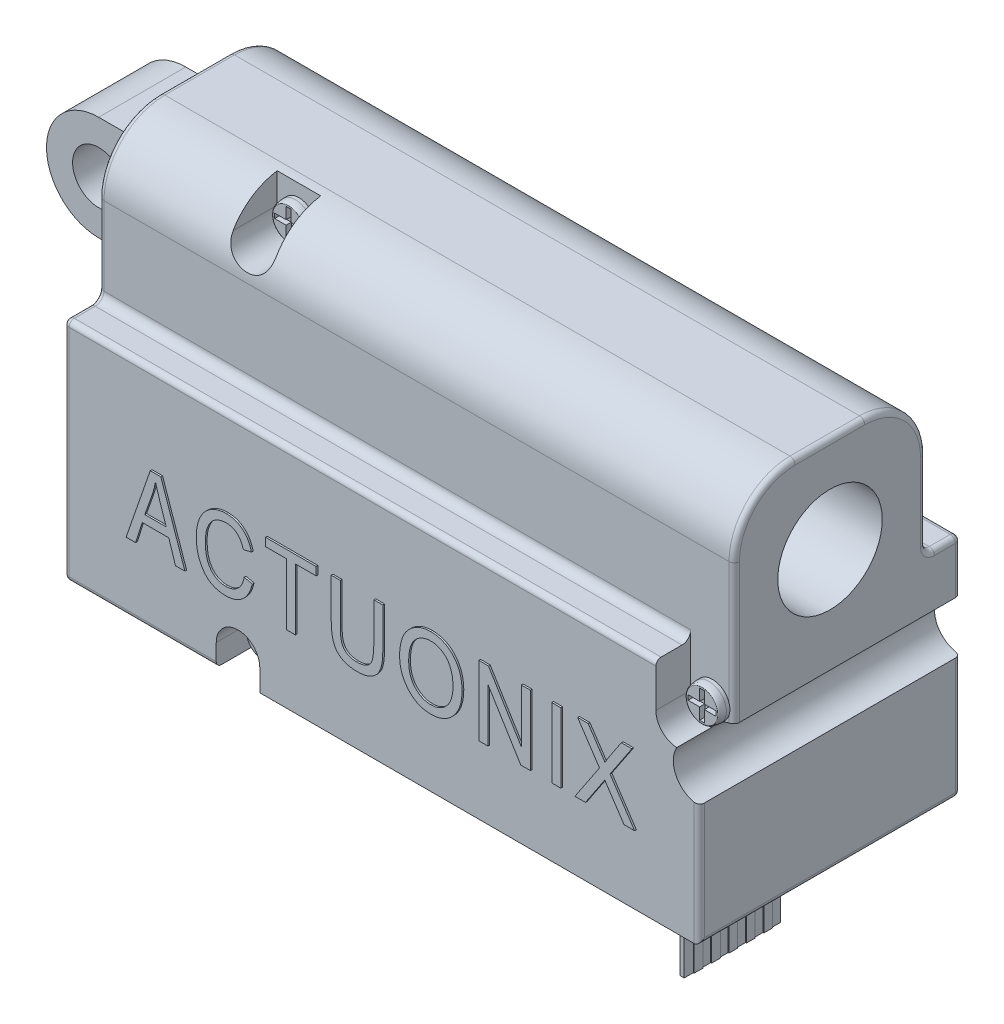
from build123d import *

# Parameters (mm, degrees)
SKETCH1_W             = 36.5
SKETCH1_H             = 21.5
BOSS_EXTRUDE1_DEPTH   = 7.5
SKETCH2_W             = 2
SKETCH2_H             = 8.5
CUT_EXTRUDE1_DEPTH    = 39.782244649
SKETCH3_W             = 5
SKETCH3_H             = 6
BOSS_EXTRUDE2_DEPTH   = 6
SKETCH4_R             = 1.5
CUT_EXTRUDE2_DEPTH    = 29.348280371
SKETCH5_R             = 1.5
CUT_EXTRUDE3_DEPTH    = 31.473349012
SKETCH7_W             = 0.51948052
SKETCH7_H             = 4
LETTERING_DEPTH       = 0.1
SKETCH8_W             = 0.5
SKETCH8_H             = 5.523886488
CUT_EXTRUDE5_DEPTH    = 1
BOSS_EXTRUDE4_DEPTH   = 0.1
SKETCH10_W            = 0.25
SKETCH10_H            = 5.523886488
WIRES_2_DEPTH         = 7
SKETCH11_W            = 0.5
SKETCH11_H            = 7
BOSS_EXTRUDE6_DEPTH   = 0.05
CUT_EXTRUDE6_DEPTH    = 2
CUT_EXTRUDE7_DEPTH    = 3
SKETCH14_R            = 1
BOSS_EXTRUDE7_DEPTH   = 0.6
BOSS_EXTRUDE7_2_DEPTH = 0.6
SKETCH15_W            = 0.6625
SKETCH15_H            = 0.275
SKETCH15_W_2          = 0.275
SKETCH15_H_2          = 0.6625
CUT_EXTRUDE8_DEPTH    = 0.3
SKETCH16_R            = 1
BOSS_EXTRUDE8_DEPTH   = 0.6
SKETCH17_W            = 0.275
SKETCH17_H            = 0.6625
SKETCH17_W_2          = 0.6625
SKETCH17_H_2          = 0.275
CUT_EXTRUDE9_DEPTH    = 0.3
FILLET6_SIZE          = 0.4
FILLET6_SIZE_2        = 0.1
FILLET7_SIZE          = 0.4
FILLET7_SIZE_2        = 0.1
FILLET8_SIZE          = 0.4
FILLET8_SIZE_2        = 0.1
FILLET1_R             = 3.5
FILLET2_R             = 1
FILLET3_R             = 0.5
FILLET4_R             = 0.5
FILLET5_R             = 0.3
SKETCH6_R             = 3
CUT_EXTRUDE4_DEPTH    = 25


with BuildPart() as part:
    # Sketch1 → Boss-Extrude1 (new, symmetric)
    with BuildSketch(Plane.XY):
        Rectangle(SKETCH1_W, SKETCH1_H)
    extrude(amount=BOSS_EXTRUDE1_DEPTH, both=True)

    # Sketch2 → Cut-Extrude1 (cut, through all)
    with BuildSketch(Plane(origin=(18.25, 0, 0), x_dir=(0, 0, -1), z_dir=(1, 0, 0))):
        with Locations((-6.5, 6.5)):
            Rectangle(SKETCH2_W, SKETCH2_H)
        with Locations((6.5, 6.5)):
            Rectangle(SKETCH2_W, SKETCH2_H)
    extrude(amount=-CUT_EXTRUDE1_DEPTH, mode=Mode.SUBTRACT)

    # Sketch3 → Boss-Extrude2 (add)
    with BuildSketch(Plane.ZY.offset(18.25)):
        with Locations((0, 5.25)):
            Rectangle(SKETCH3_W, SKETCH3_H)
    extrude(amount=BOSS_EXTRUDE2_DEPTH)

    # Sketch4 → Cut-Extrude2 (cut, through all)
    with BuildSketch(Plane.XY.offset(2.5)):
        with BuildLine():
            ThreePointArc((-24.25, 5.25), (-23.371320344, 7.371320344), (-21.25, 8.25))
            Line((-21.25, 8.25), (-24.25, 8.25))
            Line((-24.25, 8.25), (-24.25, 5.25))
        make_face()
        with BuildLine():
            Line((-24.25, 2.25), (-21.25, 2.25))
            ThreePointArc((-21.25, 2.25), (-23.371320344, 3.128679656), (-24.25, 5.25))
            Line((-24.25, 5.25), (-24.25, 2.25))
        make_face()
        with Locations((-21.25, 5.25)):
            Circle(SKETCH4_R)
    extrude(amount=-CUT_EXTRUDE2_DEPTH, mode=Mode.SUBTRACT)

    # Sketch5 → Cut-Extrude3 (cut, through all)
    with BuildSketch(Plane.XY.offset(7.5)):
        with Locations((18.25, -2.25)):
            Circle(SKETCH5_R)
    extrude(amount=-CUT_EXTRUDE3_DEPTH, mode=Mode.SUBTRACT)

    # Sketch7 → Lettering (add)
    # profile 1 of 8: a face of its own
    with BuildSketch(Plane.XY.offset(7.5)):
        Polygon((-14.576623377, -6.75), (-13.191071429, -2.75), (-12.58474026, -2.75), (-11.2, -6.75), (-11.744642857, -6.75), (-12.125324675, -5.555194805), (-13.651298701, -5.555194805), (-14.031980519, -6.75), align=None)
        with BuildLine():
            Line((-13.501948052, -5.087662338), (-12.274675325, -5.087662338))
            Line((-12.274675325, -5.087662338), (-12.639935065, -3.988636364))
            add(Edge.make_bspline(
                [(-12.639935065, -3.988636364), (-12.65351375, -3.947527264), (-12.680027416, -3.86725786), (-12.717907401, -3.749746161), (-12.754167393, -3.63825963), (-12.786379727, -3.532378588), (-12.815469797, -3.432419975), (-12.842520621, -3.338609172), (-12.866920344, -3.250751988), (-12.881375447, -3.193748887), (-12.888311688, -3.166396104)],
                knots=[0, 0, 0, 0, 1.209410234, 2.361487807, 3.449058128, 4.484314046, 5.452976395, 6.357250795, 7.211731278, 8, 8, 8, 8], degree=3))
            add(Edge.make_bspline(
                [(-12.888311688, -3.166396104), (-12.901124878, -3.230075207), (-12.926741471, -3.357384774), (-12.973319058, -3.547258788), (-13.027450773, -3.736275415), (-13.069383114, -3.861081563), (-13.090422078, -3.923701299)],
                knots=[0, 0, 0, 0, 0.993501098, 1.986243324, 2.98962581, 4, 4, 4, 4], degree=3))
            Line((-13.090422078, -3.923701299), (-13.501948052, -5.087662338))
        make_face(mode=Mode.SUBTRACT)
    # profile 2 of 8: a face of its own
    with BuildSketch(Plane.XY.offset(7.5)):
        with BuildLine():
            Line((-7.792207792, -5.347402597), (-7.324675325, -5.451298701))
            add(Edge.make_bspline(
                [(-7.324675325, -5.451298701), (-7.338507843, -5.506447179), (-7.365542684, -5.614231621), (-7.418142329, -5.768179781), (-7.476165414, -5.912074032), (-7.542738908, -6.04496921), (-7.617774687, -6.166698293), (-7.698608355, -6.278963676), (-7.788572676, -6.379120178), (-7.885390202, -6.468700678), (-7.988420918, -6.547487897), (-8.097526444, -6.615465217), (-8.21190664, -6.673069348), (-8.331730731, -6.720257116), (-8.456909189, -6.757236415), (-8.587689795, -6.782430923), (-8.723834237, -6.799756731), (-8.816502321, -6.801209252), (-8.863636364, -6.801948052)],
                knots=[0, 0, 0, 0, 1.220293167, 2.384990924, 3.489669754, 4.549651254, 5.57188532, 6.557220986, 7.51582152, 8.457228578, 9.385586102, 10.296327526, 11.213420288, 12.131450933, 13.057916225, 14.011504525, 14.988585638, 16, 16, 16, 16], degree=3))
            add(Edge.make_bspline(
                [(-8.863636364, -6.801948052), (-8.905058048, -6.801419118), (-8.986688304, -6.80037674), (-9.106460448, -6.789348014), (-9.221790988, -6.772704962), (-9.332301166, -6.747983357), (-9.438876482, -6.717626517), (-9.540431245, -6.679115624), (-9.637597996, -6.634671315), (-9.729668118, -6.582173073), (-9.818184169, -6.52293947), (-9.901393032, -6.454223711), (-9.981739073, -6.378558724), (-10.056960745, -6.293706075), (-10.128817557, -6.200858259), (-10.195643045, -6.099262848), (-10.259460729, -5.989995939), (-10.318128719, -5.872834798), (-10.372152418, -5.748765883), (-10.417667338, -5.617992469), (-10.45807264, -5.48252656), (-10.489241164, -5.341069606), (-10.514621378, -5.194576317), (-10.531927893, -5.042251512), (-10.544131522, -4.884668646), (-10.545008707, -4.777621958), (-10.545454545, -4.723214286)],
                knots=[0, 0, 0, 0, 0.987444875, 1.945970532, 2.865691915, 3.764214811, 4.644225399, 5.505809035, 6.35159498, 7.189444901, 8.03046832, 8.887959934, 9.759606025, 10.659725721, 11.58885776, 12.556911331, 13.557234418, 14.604595256, 15.679628512, 16.781526208, 17.904378674, 19.048529781, 20.233287979, 21.448073357, 22.70295484, 24, 24, 24, 24], degree=3))
            add(Edge.make_bspline(
                [(-10.545454545, -4.723214286), (-10.545011349, -4.66961834), (-10.544141797, -4.564463033), (-10.531999977, -4.410110988), (-10.514590546, -4.261860909), (-10.489608069, -4.119785185), (-10.456867106, -3.984140374), (-10.418547579, -3.854397692), (-10.370736364, -3.731716174), (-10.317802854, -3.61476854), (-10.257196775, -3.505175571), (-10.19226788, -3.401844132), (-10.12266503, -3.304803719), (-10.046935004, -3.21551783), (-9.966492373, -3.133172157), (-9.88076966, -3.058318847), (-9.790363002, -2.989688546), (-9.694774651, -2.928209444), (-9.595035603, -2.874060447), (-9.492559875, -2.826818588), (-9.387380921, -2.786790523), (-9.279140063, -2.754317756), (-9.167928456, -2.729124127), (-9.053719381, -2.711644238), (-8.936952756, -2.69943788), (-8.85798646, -2.698516426), (-8.818181818, -2.698051948)],
                knots=[0, 0, 0, 0, 1.28714434, 2.525378668, 3.716880711, 4.871983872, 5.988084826, 7.067553269, 8.118870607, 9.148405561, 10.148997021, 11.124535523, 12.078797495, 13.015004836, 13.934205159, 14.841541352, 15.746266633, 16.658501295, 17.568835417, 18.470356714, 19.36722721, 20.269895764, 21.182824756, 22.103907324, 23.044234137, 24, 24, 24, 24], degree=3))
            add(Edge.make_bspline(
                [(-8.818181818, -2.698051948), (-8.774865529, -2.699077146), (-8.689364601, -2.701100759), (-8.563463317, -2.714423933), (-8.44278129, -2.739814007), (-8.325999165, -2.771248402), (-8.214589884, -2.815279728), (-8.107070087, -2.866627524), (-8.004999519, -2.929215416), (-7.907714063, -3.000508735), (-7.815798757, -3.080784043), (-7.730996424, -3.170482234), (-7.65412937, -3.269374023), (-7.582563764, -3.375839973), (-7.520641009, -3.49279894), (-7.464660804, -3.617740579), (-7.415324234, -3.751604995), (-7.38972891, -3.845023973), (-7.376623377, -3.892857143)],
                knots=[0, 0, 0, 0, 1.022275984, 2.017844681, 2.982003421, 3.930067028, 4.867949935, 5.804571516, 6.73859987, 7.688703687, 8.647902883, 9.614426418, 10.596638918, 11.600688327, 12.637652993, 13.715085674, 14.83005897, 16, 16, 16, 16], degree=3))
            Line((-7.376623377, -3.892857143), (-7.844155844, -3.996753247))
            add(Edge.make_bspline(
                [(-7.844155844, -3.996753247), (-7.85464396, -3.963093169), (-7.875118898, -3.897381842), (-7.910746313, -3.802881022), (-7.950735459, -3.715256431), (-7.993369371, -3.63331355), (-8.041555622, -3.558825531), (-8.092708175, -3.490390556), (-8.147188722, -3.427847472), (-8.206639604, -3.372904194), (-8.26930522, -3.323943922), (-8.335614238, -3.281043995), (-8.406288264, -3.245676607), (-8.480643548, -3.216119319), (-8.558693841, -3.193541851), (-8.640415775, -3.177299478), (-8.725944033, -3.167354867), (-8.78433431, -3.166182516), (-8.814123377, -3.165584416)],
                knots=[0, 0, 0, 0, 1.220199917, 2.382078738, 3.492743967, 4.55265868, 5.57620237, 6.559539882, 7.508379445, 8.442687966, 9.356879029, 10.258317357, 11.171356441, 12.087847118, 13.024359035, 13.979417542, 14.969156017, 16, 16, 16, 16], degree=3))
            add(Edge.make_bspline(
                [(-8.814123377, -3.165584416), (-8.843907365, -3.16595512), (-8.902509009, -3.166684503), (-8.988943327, -3.175352184), (-9.0722254, -3.187946225), (-9.15243404, -3.206095286), (-9.229896696, -3.228620066), (-9.304200284, -3.256981298), (-9.375653201, -3.29049159), (-9.443537771, -3.329638096), (-9.50923178, -3.373067105), (-9.569737131, -3.424388832), (-9.628696883, -3.479047249), (-9.683214877, -3.540926969), (-9.735219746, -3.607852728), (-9.782729721, -3.681315876), (-9.827899349, -3.759667056), (-9.869001832, -3.844032858), (-9.906587995, -3.933783311), (-9.937911501, -4.029797062), (-9.965938753, -4.130923833), (-9.987075242, -4.238509187), (-10.0055166, -4.35129149), (-10.017151264, -4.47031038), (-10.024654274, -4.594869102), (-10.025528761, -4.679912545), (-10.025974026, -4.723214286)],
                knots=[0, 0, 0, 0, 0.959151106, 1.887182805, 2.795730556, 3.671188784, 4.534456022, 5.392426551, 6.230734837, 7.074012927, 7.915306618, 8.763480608, 9.626703842, 10.503289512, 11.416840776, 12.354847438, 13.319212219, 14.328838396, 15.376139039, 16.451111898, 17.580236346, 18.754612153, 19.981261172, 21.260541797, 22.605144554, 24, 24, 24, 24], degree=3))
            add(Edge.make_bspline(
                [(-10.025974026, -4.723214286), (-10.025216355, -4.788190237), (-10.023746062, -4.914278851), (-10.007373086, -5.097108473), (-9.984547863, -5.2680491), (-9.948168183, -5.425716837), (-9.904201955, -5.571399829), (-9.849011943, -5.704129326), (-9.783831944, -5.82443621), (-9.70922545, -5.932255067), (-9.624960843, -6.026411591), (-9.534861704, -6.109254575), (-9.437322685, -6.178607975), (-9.333608141, -6.23633287), (-9.222557091, -6.279745026), (-9.105399806, -6.311928002), (-8.981390522, -6.330628836), (-8.896436705, -6.333136111), (-8.853084416, -6.334415584)],
                knots=[0, 0, 0, 0, 1.385190916, 2.688022233, 3.911987166, 5.059762054, 6.134700928, 7.153741068, 8.119372781, 9.047723265, 9.942790484, 10.808687405, 11.652464049, 12.489168403, 13.333457801, 14.188677601, 15.075674591, 16, 16, 16, 16], degree=3))
            add(Edge.make_bspline(
                [(-8.853084416, -6.334415584), (-8.820853935, -6.333597523), (-8.757274054, -6.331983762), (-8.663862161, -6.320369397), (-8.57364377, -6.301705003), (-8.486741524, -6.275240178), (-8.403682176, -6.239363344), (-8.322852742, -6.198639095), (-8.246204237, -6.148400487), (-8.173309164, -6.090939494), (-8.104651099, -6.025845523), (-8.04198119, -5.952291289), (-7.985059084, -5.870672783), (-7.93395343, -5.781324032), (-7.889260229, -5.683952741), (-7.850496283, -5.578881675), (-7.816893925, -5.466173851), (-7.800559767, -5.387586069), (-7.792207792, -5.347402597)],
                knots=[0, 0, 0, 0, 0.973965102, 1.921305061, 2.840267794, 3.755913685, 4.661093029, 5.571759363, 6.488098773, 7.425504551, 8.374078967, 9.342639517, 10.340814204, 11.377406182, 12.449421082, 13.574960536, 14.760029829, 16, 16, 16, 16], degree=3))
        make_face()
    # profile 3 of 8: a face of its own
    with BuildSketch(Plane.XY.offset(7.5)):
        Polygon((-5.371428571, -6.75), (-5.371428571, -3.217532468), (-6.566233766, -3.217532468), (-6.566233766, -2.75), (-3.657142857, -2.75), (-3.657142857, -3.217532468), (-4.851948052, -3.217532468), (-4.851948052, -6.75), align=None)
    # profile 4 of 8: a face of its own
    with BuildSketch(Plane.XY.offset(7.5)):
        with BuildLine():
            Line((-0.353246753, -2.75), (0.166233766, -2.75))
            Line((0.166233766, -2.75), (0.166233766, -5.051948052))
            add(Edge.make_bspline(
                [(0.166233766, -5.051948052), (0.166106517, -5.099037656), (0.165857738, -5.191100992), (0.15852212, -5.326117275), (0.149801751, -5.454842727), (0.13443683, -5.576805544), (0.117488578, -5.692410735), (0.093989325, -5.801298053), (0.068988455, -5.904373617), (0.037682196, -6.000781849), (0.002181284, -6.091728394), (-0.040348515, -6.17760277), (-0.089650309, -6.258641274), (-0.146121244, -6.334511002), (-0.208790305, -6.405456425), (-0.27840575, -6.471244388), (-0.353711945, -6.533503125), (-0.43678827, -6.588921156), (-0.525053103, -6.639784798), (-0.620243332, -6.682531087), (-0.720397235, -6.720049585), (-0.826900639, -6.749923013), (-0.938838266, -6.773684654), (-1.056932246, -6.789092122), (-1.180406741, -6.800490531), (-1.26474438, -6.801455507), (-1.307792208, -6.801948052)],
                knots=[0, 0, 0, 0, 1.284233155, 2.510762038, 3.68754514, 4.802511647, 5.862997644, 6.873298535, 7.839874488, 8.754776576, 9.635987794, 10.500727489, 11.365215201, 12.219849526, 13.077283435, 13.943816381, 14.830204351, 15.739043759, 16.664511467, 17.605735432, 18.581816022, 19.579339969, 20.620047603, 21.700302784, 22.826182843, 24, 24, 24, 24], degree=3))
            add(Edge.make_bspline(
                [(-1.307792208, -6.801948052), (-1.367914729, -6.801087624), (-1.484683449, -6.799416519), (-1.653962117, -6.779930449), (-1.811907239, -6.750706399), (-1.958119947, -6.708736002), (-2.092199466, -6.653679057), (-2.21593425, -6.588548181), (-2.326666538, -6.508968288), (-2.426989347, -6.41785641), (-2.515428446, -6.310361595), (-2.590654135, -6.184281346), (-2.653408646, -6.039887724), (-2.706497152, -5.87808629), (-2.746296392, -5.697486299), (-2.773706527, -5.498508886), (-2.792192428, -5.281460489), (-2.793911495, -5.130453007), (-2.794805195, -5.051948052)],
                knots=[0, 0, 0, 0, 1.084700636, 2.106683185, 3.071181054, 3.981486811, 4.846658298, 5.683481954, 6.499279031, 7.301173437, 8.123435026, 9.00201022, 9.942153052, 10.959879466, 12.071198949, 13.274996868, 14.583340067, 16, 16, 16, 16], degree=3))
            Line((-2.794805195, -5.051948052), (-2.794805195, -2.75))
            Line((-2.794805195, -2.75), (-2.275324675, -2.75))
            Line((-2.275324675, -2.75), (-2.275324675, -5.054383117))
            add(Edge.make_bspline(
                [(-2.275324675, -5.054383117), (-2.274954117, -5.097945997), (-2.274238152, -5.18211482), (-2.27044452, -5.303662905), (-2.263192596, -5.416011758), (-2.252971182, -5.518952866), (-2.239046836, -5.612324752), (-2.223277621, -5.696474905), (-2.203689357, -5.771214629), (-2.175581115, -5.857791863), (-2.128750266, -5.953063604), (-2.058236743, -6.0540515), (-1.971803871, -6.140450387), (-1.870009879, -6.211472991), (-1.754600746, -6.266409988), (-1.627614415, -6.306304226), (-1.489132078, -6.329933112), (-1.393113258, -6.332888648), (-1.343506494, -6.334415584)],
                knots=[0, 0, 0, 0, 1.141221317, 2.204979448, 3.185171586, 4.090023792, 4.913976812, 5.657653947, 6.331552786, 6.936718419, 8.039865504, 9.097822674, 10.150304947, 11.223934664, 12.33346159, 13.485657179, 14.701000362, 16, 16, 16, 16], degree=3))
            add(Edge.make_bspline(
                [(-1.343506494, -6.334415584), (-1.301535171, -6.333701785), (-1.22038054, -6.332321603), (-1.103155106, -6.319916618), (-0.994539505, -6.300330005), (-0.895251107, -6.270713859), (-0.804493148, -6.234726325), (-0.72280408, -6.189588042), (-0.650565205, -6.135715964), (-0.585142843, -6.073826183), (-0.528772382, -5.998969424), (-0.482273398, -5.908827228), (-0.441644506, -5.804126432), (-0.40889101, -5.683863986), (-0.384481359, -5.547988392), (-0.365740633, -5.39736414), (-0.35579352, -5.230922362), (-0.354121229, -5.115000898), (-0.353246753, -5.054383117)],
                knots=[0, 0, 0, 0, 1.066557885, 2.062267932, 2.99298675, 3.867801605, 4.69154568, 5.470429187, 6.232460853, 6.976655931, 7.752436183, 8.601598288, 9.546689851, 10.60288661, 11.764278551, 13.053225541, 14.459069418, 16, 16, 16, 16], degree=3))
            Line((-0.353246753, -5.054383117), (-0.353246753, -2.75))
        make_face()
    # profile 5 of 8: a face of its own
    with BuildSketch(Plane.XY.offset(7.5)):
        with BuildLine():
            add(Edge.make_bspline(
                [(1.132467532, -4.80275974), (1.133923282, -4.720712905), (1.136759891, -4.560840007), (1.161679144, -4.328603483), (1.200722589, -4.110701229), (1.256639277, -3.907597013), (1.328853741, -3.718984757), (1.417567745, -3.544925791), (1.522752951, -3.385679567), (1.643278854, -3.242099004), (1.775046341, -3.114070461), (1.916597063, -3.003106148), (2.065349838, -2.907895165), (2.223237269, -2.83188098), (2.387937512, -2.77067406), (2.561328064, -2.729368149), (2.741987141, -2.702055126), (2.865319052, -2.699399791), (2.927922078, -2.698051948)],
                knots=[0, 0, 0, 0, 1.263431084, 2.461866925, 3.593164393, 4.669969747, 5.701635473, 6.698784988, 7.673171325, 8.6347017, 9.580754227, 10.4978345, 11.40079179, 12.295440074, 13.191979127, 14.101672174, 15.036412681, 16, 16, 16, 16], degree=3))
            add(Edge.make_bspline(
                [(2.927922078, -2.698051948), (2.968805472, -2.698863121), (3.04964745, -2.700467118), (3.169454102, -2.712308831), (3.286716489, -2.730568332), (3.4012836, -2.757792745), (3.513541078, -2.791453229), (3.622576994, -2.834225994), (3.728981239, -2.883587122), (3.832103985, -2.940432788), (3.931306633, -3.00445781), (4.025372753, -3.076221447), (4.115142459, -3.154029126), (4.198651596, -3.239567163), (4.276971699, -3.331823091), (4.349958844, -3.430789532), (4.417485705, -3.536961502), (4.479819089, -3.649328517), (4.535894239, -3.767983236), (4.58490147, -3.892314119), (4.624930615, -4.022811552), (4.659462722, -4.158098406), (4.68512745, -4.299445499), (4.703894368, -4.446000753), (4.714198758, -4.598337418), (4.71597805, -4.701555051), (4.716883117, -4.754058442)],
                knots=[0, 0, 0, 0, 0.961926932, 1.902094409, 2.830547297, 3.752537684, 4.67095983, 5.586109941, 6.506163741, 7.429450247, 8.354841813, 9.281874629, 10.211440208, 11.14791392, 12.091953956, 13.057204343, 14.039212897, 15.050927152, 16.079075996, 17.125436721, 18.192721555, 19.289102544, 20.409258653, 21.570932135, 22.764413651, 24, 24, 24, 24], degree=3))
            add(Edge.make_bspline(
                [(4.716883117, -4.754058442), (4.715434725, -4.825803315), (4.712597046, -4.966365304), (4.691723102, -5.172223718), (4.654810259, -5.367768351), (4.60504858, -5.553513469), (4.539762915, -5.728647848), (4.460790936, -5.893890282), (4.366916924, -6.048900336), (4.292800993, -6.143550713), (4.255844156, -6.190746753)],
                knots=[0, 0, 0, 0, 1.117937363, 2.190254058, 3.21977568, 4.215977455, 5.183179778, 6.127956884, 7.066532784, 8, 8, 8, 8], degree=3))
            add(Edge.make_bspline(
                [(4.255844156, -6.190746753), (4.212736089, -6.239335039), (4.127990849, -6.334853725), (3.985234384, -6.459837857), (3.832979942, -6.566114165), (3.670304856, -6.652824504), (3.497663342, -6.719533615), (3.315355026, -6.767643994), (3.123098064, -6.796358323), (2.991602002, -6.800062673), (2.924675325, -6.801948052)],
                knots=[0, 0, 0, 0, 1.027498799, 2.019938215, 2.995447625, 3.961203776, 4.930827592, 5.918866746, 6.940779422, 8, 8, 8, 8], degree=3))
            add(Edge.make_bspline(
                [(2.924675325, -6.801948052), (2.857202163, -6.800130456), (2.72484619, -6.796565043), (2.531407986, -6.766976768), (2.348597823, -6.717179221), (2.175351249, -6.64864813), (2.012381807, -6.559727397), (1.859791692, -6.450785271), (1.717041082, -6.322703511), (1.633021824, -6.224496175), (1.59025974, -6.174512987)],
                knots=[0, 0, 0, 0, 1.059233302, 2.077801789, 3.064242134, 4.02921826, 4.997034042, 5.972070175, 6.967873479, 8, 8, 8, 8], degree=3))
            add(Edge.make_bspline(
                [(1.59025974, -6.174512987), (1.553692264, -6.126410451), (1.481020792, -6.030815062), (1.387362405, -5.877084784), (1.308345312, -5.715942531), (1.244454233, -5.547272844), (1.19349218, -5.371778381), (1.158195704, -5.188659016), (1.136700286, -4.998079798), (1.133893554, -4.868563394), (1.132467532, -4.80275974)],
                knots=[0, 0, 0, 0, 0.982628282, 1.952802089, 2.92341525, 3.898778707, 4.88381997, 5.893076978, 6.929531471, 8, 8, 8, 8], degree=3))
        make_face()
        with BuildLine():
            add(Edge.make_bspline(
                [(1.651948052, -4.809253247), (1.652864537, -4.868021669), (1.654647148, -4.982329275), (1.673474377, -5.148529855), (1.700909785, -5.305165046), (1.741716353, -5.451545482), (1.793244468, -5.588187369), (1.858184302, -5.713624144), (1.932810207, -5.830211415), (2.01982115, -5.935028169), (2.114404067, -6.028783036), (2.214579764, -6.111046106), (2.320908746, -6.178869303), (2.430871806, -6.236891198), (2.546559767, -6.280567239), (2.667149773, -6.31149032), (2.79257047, -6.33063918), (2.878070636, -6.333144907), (2.921428571, -6.334415584)],
                knots=[0, 0, 0, 0, 1.266169419, 2.462764717, 3.600931822, 4.690411057, 5.733399321, 6.742780968, 7.729518729, 8.711436491, 9.672276695, 10.596748877, 11.499386426, 12.386230187, 13.272210652, 14.157672736, 15.065738575, 16, 16, 16, 16], degree=3))
            add(Edge.make_bspline(
                [(2.921428571, -6.334415584), (2.965866281, -6.333142526), (3.053247975, -6.330639202), (3.181452281, -6.311629583), (3.304026451, -6.280088986), (3.420835485, -6.234814662), (3.532468745, -6.177880508), (3.638769761, -6.10843423), (3.738963583, -6.02575347), (3.833069133, -5.930837083), (3.919233445, -5.823893241), (3.994584989, -5.704541815), (4.056694604, -5.572505888), (4.108985269, -5.429487558), (4.148048873, -5.274022807), (4.1774696, -5.107269752), (4.194290213, -4.928376222), (4.19634541, -4.805229483), (4.197402597, -4.741883117)],
                knots=[0, 0, 0, 0, 0.927913641, 1.824636478, 2.700513548, 3.566360566, 4.435796468, 5.313567565, 6.212993094, 7.144084972, 8.100806857, 9.07604339, 10.084604769, 11.142951278, 12.251828903, 13.428071361, 14.677006512, 16, 16, 16, 16], degree=3))
            add(Edge.make_bspline(
                [(4.197402597, -4.741883117), (4.196743934, -4.700199797), (4.195446473, -4.618090393), (4.186198834, -4.496465088), (4.171774965, -4.378338036), (4.151671335, -4.263338114), (4.124681563, -4.152037507), (4.092115967, -4.043955175), (4.054450799, -3.938702283), (4.023642361, -3.87128239), (4.008279221, -3.837662338)],
                knots=[0, 0, 0, 0, 1.074070125, 2.115744592, 3.141382573, 4.139785726, 5.122287222, 6.090610392, 7.047851067, 8, 8, 8, 8], degree=3))
            add(Edge.make_bspline(
                [(4.008279221, -3.837662338), (3.982355126, -3.788371618), (3.930975438, -3.690680962), (3.829107481, -3.559342001), (3.708666277, -3.444215978), (3.594544149, -3.362330522), (3.496940189, -3.305351636), (3.421277571, -3.267899505), (3.343759266, -3.236037127), (3.264596977, -3.209981125), (3.183298699, -3.190761729), (3.101010338, -3.175739803), (3.016548254, -3.16784266), (2.959862274, -3.166343343), (2.931168831, -3.165584416)],
                knots=[0, 0, 0, 0, 1.49536845, 2.963712579, 4.445710843, 5.962222937, 6.728422237, 7.483311059, 8.230481807, 8.980551729, 9.72171158, 10.475301985, 11.228224764, 12, 12, 12, 12], degree=3))
            add(Edge.make_bspline(
                [(2.931168831, -3.165584416), (2.885650507, -3.16685026), (2.796385357, -3.169332684), (2.665476996, -3.18833504), (2.540879927, -3.2199527), (2.422301888, -3.264189335), (2.309541902, -3.320185747), (2.203304366, -3.39000171), (2.103402782, -3.472394629), (2.009604144, -3.566612584), (1.924466863, -3.674124392), (1.851546067, -3.796438286), (1.788762917, -3.931472018), (1.738925523, -4.080874609), (1.698920546, -4.243394559), (1.672520309, -4.420037202), (1.654797412, -4.610028562), (1.65291997, -4.741297608), (1.651948052, -4.809253247)],
                knots=[0, 0, 0, 0, 0.927132261, 1.818182038, 2.688547624, 3.541474334, 4.391975012, 5.248173059, 6.125493334, 7.025906057, 7.95225139, 8.911804577, 9.920513176, 10.980385494, 12.115471112, 13.326255262, 14.615850128, 16, 16, 16, 16], degree=3))
        make_face(mode=Mode.SUBTRACT)
    # profile 6 of 8: a face of its own
    with BuildSketch(Plane.XY.offset(7.5)):
        Polygon((5.683116883, -6.75), (5.683116883, -2.75), (6.23262987, -2.75), (8.124675325, -5.82711039), (8.124675325, -2.75), (8.644155844, -2.75), (8.644155844, -6.75), (8.091396104, -6.75), (6.202597403, -3.678571429), (6.202597403, -6.75), align=None)
    # profile 7 of 8: a face of its own
    with BuildSketch(Plane.XY.offset(7.5)):
        with Locations((10.12987013, -4.75)):
            Rectangle(SKETCH7_W, SKETCH7_H)
    # profile 8 of 8: a face of its own
    with BuildSketch(Plane.XY.offset(7.5)):
        with BuildLine():
            Line((11.2, -6.75), (12.611525974, -4.633928571))
            Line((12.611525974, -4.633928571), (11.355844156, -2.75))
            Line((11.355844156, -2.75), (11.961363636, -2.75))
            Line((11.961363636, -2.75), (12.62775974, -3.749188312))
            add(Edge.make_bspline(
                [(12.62775974, -3.749188312), (12.644813819, -3.774615421), (12.677626152, -3.823537607), (12.724763047, -3.894115668), (12.76767908, -3.959299815), (12.807668423, -4.018679244), (12.843884903, -4.072366845), (12.875891529, -4.120924459), (12.904052295, -4.163838972), (12.922103832, -4.190495004), (12.930519481, -4.202922078)],
                knots=[0, 0, 0, 0, 1.347087419, 2.591818869, 3.734203168, 4.78083933, 5.741632408, 6.58356599, 7.339656759, 8, 8, 8, 8], degree=3))
            add(Edge.make_bspline(
                [(12.930519481, -4.202922078), (12.945430396, -4.173033852), (12.977378041, -4.108996306), (13.033585061, -4.009692123), (13.100560752, -3.900392053), (13.15024142, -3.825329517), (13.176461039, -3.785714286)],
                knots=[0, 0, 0, 0, 0.826842382, 1.771565708, 2.823914786, 4, 4, 4, 4], degree=3))
            Line((13.176461039, -3.785714286), (13.867207792, -2.75))
            Line((13.867207792, -2.75), (14.472727273, -2.75))
            Line((14.472727273, -2.75), (13.217045455, -4.633116883))
            Line((13.217045455, -4.633116883), (14.628571429, -6.75))
            Line((14.628571429, -6.75), (14.023051948, -6.75))
            Line((14.023051948, -6.75), (13.058766234, -5.303571429))
            add(Edge.make_bspline(
                [(13.058766234, -5.303571429), (13.033638229, -5.265669748), (12.985662808, -5.193306298), (12.937311934, -5.121193195), (12.914285714, -5.086850649)],
                knots=[0, 0, 0, 0, 1.047536591, 2, 2, 2, 2], degree=3))
            add(Edge.make_bspline(
                [(12.914285714, -5.086850649), (12.893759238, -5.117718838), (12.855947307, -5.174581291), (12.80366759, -5.252104953), (12.762812669, -5.315864382), (12.737678529, -5.352590056), (12.726785714, -5.368506494)],
                knots=[0, 0, 0, 0, 1.314685404, 2.421788902, 3.316023523, 4, 4, 4, 4], degree=3))
            Line((12.726785714, -5.368506494), (11.805519481, -6.75))
            Line((11.805519481, -6.75), (11.2, -6.75))
        make_face()
    extrude(amount=LETTERING_DEPTH)

    # Sketch8 → Cut-Extrude5 (cut)
    with BuildSketch(Plane.XZ.offset(10.75)):
        with Locations((13.25, 0.738056756)):
            Rectangle(SKETCH8_W, SKETCH8_H)
    extrude(amount=-CUT_EXTRUDE5_DEPTH, mode=Mode.SUBTRACT)

    # Sketch9 → Boss-Extrude4 (add)
    with BuildSketch(Plane.XZ.offset(10.75)):
        with BuildLine():
            Line((14.5, -2.75), (14.5, 3.5))
            Line((14.5, 3.5), (13.5, 3.5))
            Line((13.5, 3.5), (13.5, -2.023886488))
            Line((13.5, -2.023886488), (13, -2.023886488))
            Line((13, -2.023886488), (13, 3.5))
            Line((13, 3.5), (12, 3.5))
            Line((12, 3.5), (12, -2.75))
            ThreePointArc((12, -2.75), (13.25, -4), (14.5, -2.75))
        make_face()
    extrude(amount=BOSS_EXTRUDE4_DEPTH)

    # Sketch12 → Cut-Extrude6 (cut)
    with BuildSketch(Plane.XY.offset(7.5)):
        with BuildLine():
            ThreePointArc((18.25, 2.25), (17, 3.5), (15.75, 2.25))
            Line((15.75, 2.25), (15.75, -0.25))
            ThreePointArc((15.75, -0.25), (16.099134325, -1.11656854), (16.951505656, -1.499058965))
            ThreePointArc((16.951505656, -1.499058965), (17.500470665, -0.950690269), (18.25, -0.75))
            Line((18.25, -0.75), (18.25, 2.25))
        make_face()
        with BuildLine():
            Line((-9.5, -9.5), (-9.5, -10.75))
            ThreePointArc((-9.5, -10.75), (-8.25, -12), (-7, -10.75))
            Line((-7, -10.75), (-7, -9.5))
            ThreePointArc((-7, -9.5), (-8.25, -8.25), (-9.5, -9.5))
        make_face()
    extrude(amount=-CUT_EXTRUDE6_DEPTH, mode=Mode.SUBTRACT)

    # Sketch13 → Cut-Extrude7 (cut)
    with BuildSketch(Plane.XY.offset(5.5)):
        with BuildLine():
            Line((-8.5, 10.75), (-8.5, 9))
            ThreePointArc((-8.5, 9), (-9.75, 7.75), (-11, 9))
            Line((-11, 9), (-11, 10.75))
            ThreePointArc((-11, 10.75), (-9.75, 12), (-8.5, 10.75))
        make_face()
    extrude(amount=-CUT_EXTRUDE7_DEPTH, mode=Mode.SUBTRACT)

    # Fillet1
    # the kernel refuses this fillet: 3.5 mm, written as the material it takes off along each edge
    with BuildSketch(Plane(origin=(-2.25, 10.75, 5.5), x_dir=(0, 0, -1), z_dir=(-1, 0, 0))) as fillet1_piece_1:
        with BuildLine():
            CenterArc((FILLET1_R, FILLET1_R), FILLET1_R, 180, 90)
            Line((0, FILLET1_R), (0, 0))
            Line((0, 0), (FILLET1_R, 0))
        make_face()
    extrude(amount=24.75, mode=Mode.SUBTRACT)
    with BuildSketch(Plane(origin=(27, 10.75, -5.5), x_dir=(0, 0, 1), z_dir=(-1, 0, 0))) as fillet1_piece_2:
        with BuildLine():
            CenterArc((FILLET1_R, -FILLET1_R), FILLET1_R, 90, 90)
            Line((0, -FILLET1_R), (0, 0))
            Line((0, 0), (FILLET1_R, 0))
        make_face()
    extrude(amount=54, mode=Mode.SUBTRACT)
    with BuildSketch(Plane(origin=(27, 10.75, 5.5), x_dir=(0, 0, -1), z_dir=(-1, 0, 0))) as fillet1_piece_3:
        with BuildLine():
            CenterArc((FILLET1_R, FILLET1_R), FILLET1_R, 180, 90)
            Line((0, FILLET1_R), (0, 0))
            Line((0, 0), (FILLET1_R, 0))
        make_face()
    extrude(amount=44.25, mode=Mode.SUBTRACT)

    # Fillet2
    fillet2_edges = [part.edges().sort_by_distance(p)[0] for p in [
        (-18.25, 8.25, 0),
        (-18.25, 2.25, 0),
    ]]
    fillet(fillet2_edges, radius=FILLET2_R)

    # Fillet3
    fillet3_edges = [part.edges().sort_by_distance(p)[0] for p in [
        (-18.25, 5.25, 2.5),
        (-18.25, 5.25, -2.5),
    ]]
    fillet(fillet3_edges, radius=FILLET3_R)

    # Fillet4
    fillet4_edges = [part.edges().sort_by_distance(p)[0] for p in [
        (-1.25, 2.25, 5.5),
        (0, 2.25, -5.5),
    ]]
    fillet(fillet4_edges, radius=FILLET4_R)

    # Fillet5
    fillet5_edges = [part.edges().sort_by_distance(p)[0] for p in [
        (-13.875, -10.75, 7.5),
        (-18.25, -4.25, -7.5),
        (-18.25, -4.25, 7.5),
        (-1.25, 2.25, 7.5),
        (0, 2.25, -7.5),
        (18.25, -7.25, 7.5),
        (18.25, 5, -5.5),
        (-18.25, 5, -5.5),
        (18.25, 3.25, 5.5),
        (18.25, 10.75, 0),
        (18.25, 9.724873734, 4.474873734),
        (18.25, 9.724873734, -4.474873734),
        (-18.25, 10.75, 0),
        (-18.25, 5, 5.5),
        (-18.25, 9.724873734, 4.474873734),
        (-18.25, 9.724873734, -4.474873734),
        (0, -10.75, -7.5),
        (-18.25, 2.25, 6.75),
        (18.25, 2.25, -6.75),
        (-18.25, 2.25, -6.75),
        (-18.25, 2.396446609, 5.646446609),
        (18.25, 2.396446609, -5.646446609),
        (-18.25, 2.396446609, -5.646446609),
        (18.25, -7.25, -7.5),
        (18.25, -10.75, 0),
        (-18.25, -10.75, 0),
        (18.25, 0.75, -7.5),
    ]]
    fillet(fillet5_edges, radius=FILLET5_R)

    # Sketch6 → Cut-Extrude4 (cut)
    with BuildSketch(Plane(origin=(18.25, 0, 0), x_dir=(0, 0, -1), z_dir=(1, 0, 0))):
        with Locations((0, 5.25)):
            Circle(SKETCH6_R)
    extrude(amount=-CUT_EXTRUDE4_DEPTH, mode=Mode.SUBTRACT)


with BuildPart() as body_2:
    # Sketch10 → Wires 2 (new body)
    with BuildSketch(Plane.XZ.offset(9.75)):
        with Locations((13.25, 0.738056756)):
            Rectangle(SKETCH10_W, SKETCH10_H)
    extrude(amount=WIRES_2_DEPTH)

    # Sketch11 → Boss-Extrude6 (add)
    with BuildSketch(Plane(origin=(13.375, 0, 0), x_dir=(0, 0, -1), z_dir=(1, 0, 0))):
        with Locations((1.272068306, -13.25)):
            Rectangle(SKETCH11_W, SKETCH11_H)
        with Locations((0.272068306, -13.25)):
            Rectangle(SKETCH11_W, SKETCH11_H)
        with Locations((-0.727931694, -13.25)):
            Rectangle(SKETCH11_W, SKETCH11_H)
        with Locations((-1.727931694, -13.25)):
            Rectangle(SKETCH11_W, SKETCH11_H)
        with Locations((-2.727931694, -13.25)):
            Rectangle(SKETCH11_W, SKETCH11_H)
    boss_extrude6 = extrude(amount=BOSS_EXTRUDE6_DEPTH)

    # Mirror1: Boss-Extrude6 across plane
    add(boss_extrude6.mirror(Plane(origin=(13.25, 0, 0), x_dir=(0, 0, 1), z_dir=(1, 0, 0))))


with BuildPart() as body_3:
    # Sketch14 → Boss-Extrude7 (new body)
    with BuildSketch(Plane.XY.offset(5.5)):
        with Locations((-8.25, -9.5)):
            Circle(SKETCH14_R)
    extrude(amount=BOSS_EXTRUDE7_DEPTH)


with BuildPart() as body_4:
    # Sketch14 → Boss-Extrude7 2 (new body)
    with BuildSketch(Plane.XY.offset(5.5)):
        with Locations((17, -0.084936491)):
            Circle(SKETCH14_R)
    extrude(amount=BOSS_EXTRUDE7_2_DEPTH)


with BuildPart() as cut_extrude8_tool:
    # Sketch15 → Cut-Extrude8 (new body)
    with BuildSketch(Plane.XY.offset(6.1)):
        with Locations((16.53125, -0.084936491)):
            Rectangle(SKETCH15_W, SKETCH15_H)
        with Locations((17, -0.084936491)):
            Rectangle(SKETCH15_W_2, SKETCH15_H)
        with Locations((17, 0.383813509)):
            Rectangle(SKETCH15_W_2, SKETCH15_H_2)
        with Locations((17.46875, -0.084936491)):
            Rectangle(SKETCH15_W, SKETCH15_H)
        with Locations((17, -0.553686491)):
            Rectangle(SKETCH15_W_2, SKETCH15_H_2)
        with Locations((-8.25, -9.96875)):
            Rectangle(SKETCH15_W_2, SKETCH15_H_2)
        with Locations((-8.71875, -9.5)):
            Rectangle(SKETCH15_W, SKETCH15_H)
        with Locations((-8.25, -9.03125)):
            Rectangle(SKETCH15_W_2, SKETCH15_H_2)
        with Locations((-7.78125, -9.5)):
            Rectangle(SKETCH15_W, SKETCH15_H)
        with Locations((-8.25, -9.5)):
            Rectangle(SKETCH15_W_2, SKETCH15_H)
    extrude(amount=-CUT_EXTRUDE8_DEPTH)


with BuildPart() as body_3_1:
    add(body_3.part)

    # Cut-Extrude8: cut by cut_extrude8_tool
    add(cut_extrude8_tool.part, mode=Mode.SUBTRACT)

    # Fillet7
    # an asymmetric fillet: 0.4, 0.1 mm, written as the material it takes off along each edge
    with BuildSketch(Plane(origin=(-8.25, -9.5, 6.1), x_dir=(1, 0, 0), z_dir=(0, -1, 0))) as fillet7_piece_1:
        with BuildLine():
            Bezier((1, -FILLET7_SIZE), (1, 0), (1 - FILLET7_SIZE_2, 0), weights=[1, 0.707106781, 1])
            Line((1 - FILLET7_SIZE_2, 0), (1, 0))
            Line((1, 0), (1, -FILLET7_SIZE))
        make_face()
    revolve(axis=Axis((-8.25, -9.5, 6.1), (0, 0, 1)), mode=Mode.SUBTRACT)


with BuildPart() as body_4_1:
    add(body_4.part)

    # Cut-Extrude8: cut by cut_extrude8_tool
    add(cut_extrude8_tool.part, mode=Mode.SUBTRACT)

    # Fillet8
    # an asymmetric fillet: 0.4, 0.1 mm, written as the material it takes off along each edge
    with BuildSketch(Plane(origin=(17, -0.084936491, 6.1), x_dir=(1, 0, 0), z_dir=(0, -1, 0))) as fillet8_piece_1:
        with BuildLine():
            Bezier((1, -FILLET8_SIZE), (1, 0), (1 - FILLET8_SIZE_2, 0), weights=[1, 0.707106781, 1])
            Line((1 - FILLET8_SIZE_2, 0), (1, 0))
            Line((1, 0), (1, -FILLET8_SIZE))
        make_face()
    revolve(axis=Axis((17, -0.084936491, 6.1), (0, 0, 1)), mode=Mode.SUBTRACT)


with BuildPart() as body_5:
    # Sketch16 → Boss-Extrude8 (new body)
    with BuildSketch(Plane.XY.offset(2.5)):
        with Locations((-9.75, 9)):
            Circle(SKETCH16_R)
    extrude(amount=BOSS_EXTRUDE8_DEPTH)

    # Sketch17 → Cut-Extrude9 (cut)
    with BuildSketch(Plane.XY.offset(3.1)):
        with Locations((-9.75, 8.53125)):
            Rectangle(SKETCH17_W, SKETCH17_H)
        with Locations((-9.28125, 9)):
            Rectangle(SKETCH17_W_2, SKETCH17_H_2)
        with Locations((-9.75, 9)):
            Rectangle(SKETCH17_W, SKETCH17_H_2)
        with Locations((-10.21875, 9)):
            Rectangle(SKETCH17_W_2, SKETCH17_H_2)
        with Locations((-9.75, 9.46875)):
            Rectangle(SKETCH17_W, SKETCH17_H)
    extrude(amount=-CUT_EXTRUDE9_DEPTH, mode=Mode.SUBTRACT)

    # Fillet6
    # an asymmetric fillet: 0.4, 0.1 mm, written as the material it takes off along each edge
    with BuildSketch(Plane(origin=(-9.75, 9, 3.1), x_dir=(1, 0, 0), z_dir=(0, -1, 0))) as fillet6_piece_1:
        with BuildLine():
            Bezier((1, -FILLET6_SIZE), (1, 0), (1 - FILLET6_SIZE_2, 0), weights=[1, 0.707106781, 1])
            Line((1 - FILLET6_SIZE_2, 0), (1, 0))
            Line((1, 0), (1, -FILLET6_SIZE))
        make_face()
    revolve(axis=Axis((-9.75, 9, 3.1), (0, 0, 1)), mode=Mode.SUBTRACT)


solid = Compound([part.part, body_2.part, body_3_1.part, body_4_1.part, body_5.part])
